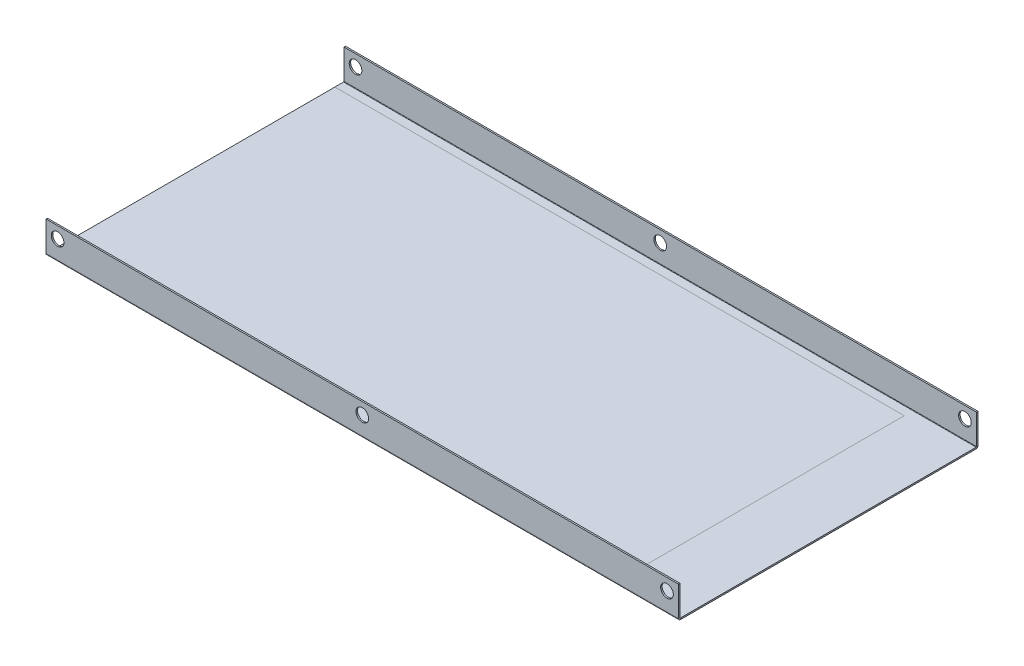
from build123d import *

# Parameters (mm, degrees)
SKETCH_1_W                         = 300
SKETCH_1_H                         = 142
SM_BASE_FLANGE_1_DEPTH             = 0.7
SM_EDGE_FLANGE_1_STRIP_W           = 3.2
SM_EDGE_FLANGE_1_STRIP_H           = 0.7
SM_EDGE_FLANGE_1_STRIP_CUT_DEPTH   = 300
SM_EDGE_FLANGE_1_STRIP_2_W         = 3.2
SM_EDGE_FLANGE_1_STRIP_2_H         = 0.7
SM_EDGE_FLANGE_1_STRIP_CUT_2_DEPTH = 300
SM_EDGE_FLANGE_1_DEPTH             = 300
SM_EDGE_FLANGE_1_BEND_DEPTH        = 300
SKETCH_18_R                        = 3
CUT_EXTRUDE_1_DEPTH                = 10
CUT_EXTRUDE_START                  = -10
SKETCH_20_R                        = 3
CUT_EXTRUDE_2_DEPTH                = 10
SPLIT_BODIES_1_SURFACE_1_BACK      = 333.248
SPLIT_BODIES_1_SURFACE_1_DEPTH     = 666.496
SPLIT_BODIES_1_SURFACE_2_BACK      = 333.248
SPLIT_BODIES_1_SURFACE_2_DEPTH     = 666.496


# Sheet-metal steps are written as plain solids
with BuildPart() as part:
    # 草图1 → 基体-法兰1 (new body)
    with BuildSketch(Plane(origin=(0, 0, 0), x_dir=(1, 0, 0), z_dir=(0, 1, 0))):
        Rectangle(SKETCH_1_W, SKETCH_1_H)
    extrude(amount=-SM_BASE_FLANGE_1_DEPTH)

    # 边线-法兰1 strip (across the edge) → 边线-法兰1 strip cut (cut)
    with BuildSketch(Plane(origin=(150, 0, -71), x_dir=(0, 0, 1), z_dir=(-1, 0, 0))):
        with Locations((-0.7, -0.35)):
            Rectangle(SM_EDGE_FLANGE_1_STRIP_W, SM_EDGE_FLANGE_1_STRIP_H)
    extrude(amount=SM_EDGE_FLANGE_1_STRIP_CUT_DEPTH, mode=Mode.SUBTRACT)

    # 边线-法兰1 strip 2 (across the edge) → 边线-法兰1 strip cut 2 (cut)
    with BuildSketch(Plane(origin=(-150, 0, 71), x_dir=(0, 0, -1), z_dir=(1, 0, 0))):
        with Locations((-0.7, -0.35)):
            Rectangle(SM_EDGE_FLANGE_1_STRIP_2_W, SM_EDGE_FLANGE_1_STRIP_2_H)
    extrude(amount=SM_EDGE_FLANGE_1_STRIP_CUT_2_DEPTH, mode=Mode.SUBTRACT)

    # 边线-法兰1 section (across the edge) → 边线-法兰1 (add)
    with BuildSketch(Plane(origin=(150, 0, -71), x_dir=(0, 0, 1), z_dir=(-1, 0, 0))):
        with BuildLine():
            Line((0, 0.2), (0, 14.3))
            Line((0, 14.3), (0.7, 14.3))
            Line((0.7, 14.3), (0.7, 0.2))
            ThreePointArc((0.7, 0.2), (0.758578644, 0.058578644), (0.9, 0))
            Line((0.9, 0), (0.9, -0.7))
            ThreePointArc((0.9, -0.7), (0.263603897, -0.436396103), (0, 0.2))
        make_face()
    extrude(amount=SM_EDGE_FLANGE_1_DEPTH)

    # 边线-法兰1 section 2 (across the edge) → 边线-法兰1 bend (add)
    with BuildSketch(Plane(origin=(-150, 0, 71), x_dir=(0, 0, -1), z_dir=(1, 0, 0))):
        with BuildLine():
            Line((0, 0.2), (0, 14.3))
            Line((0, 14.3), (0.7, 14.3))
            Line((0.7, 14.3), (0.7, 0.2))
            ThreePointArc((0.7, 0.2), (0.758578644, 0.058578644), (0.9, 0))
            Line((0.9, 0), (0.9, -0.7))
            ThreePointArc((0.9, -0.7), (0.263603897, -0.436396103), (0, 0.2))
        make_face()
    extrude(amount=SM_EDGE_FLANGE_1_BEND_DEPTH)

    # 草图18 → 切除-拉伸1 (cut)
    with BuildSketch(Plane(origin=(0, 0, -71), x_dir=(-1, 0, 0), z_dir=(0, 0, -1))):
        with Locations(Location((-144.5, 8.8, 0), (0, 0, 90))):
            Circle(SKETCH_18_R)
        with Locations(Location((0, 8.8, 0), (0, 0, 90))):
            Circle(SKETCH_18_R)
        with Locations(Location((144.5, 8.8, 0), (0, 0, 270))):
            Circle(SKETCH_18_R)
    extrude(amount=-CUT_EXTRUDE_1_DEPTH, mode=Mode.SUBTRACT)

    # 草图20 → 切除-拉伸2 (cut)
    with BuildSketch(Plane.XY.offset(71).offset(CUT_EXTRUDE_START)):
        with Locations(Location((-144.5, 8.8, 0), (0, 0, 270))):
            Circle(SKETCH_20_R)
        with Locations(Location((0, 8.8, 0), (0, 0, 90))):
            Circle(SKETCH_20_R)
        with Locations(Location((144.5, 8.8, 0), (0, 0, 90))):
            Circle(SKETCH_20_R)
    extrude(amount=CUT_EXTRUDE_2_DEPTH, mode=Mode.SUBTRACT)


with BuildPart() as body_2:
    # Split Bodies 1: the piece behind the surface
    add(part.part)
    # Split Bodies 1 surface: a surface, the sketch's curves swept straight by 666.496 mm
    with BuildLine(Plane(origin=(0, 0, 0), x_dir=(1, 0, 0), z_dir=(0, 1, 0)).offset(-SPLIT_BODIES_1_SURFACE_1_BACK), mode=Mode.PRIVATE) as split_bodies_1_surface_1_path:
        Line((-150, 66), (120, 66))
        Line((120, 66), (120, -66))
        Line((120, -66), (-150, -66))
    split_bodies_1_surface_1 = Shell.extrude(split_bodies_1_surface_1_path.wire(), (0 * SPLIT_BODIES_1_SURFACE_1_DEPTH, 1 * SPLIT_BODIES_1_SURFACE_1_DEPTH, 0 * SPLIT_BODIES_1_SURFACE_1_DEPTH))
    split(bisect_by=split_bodies_1_surface_1, keep=Keep.BOTTOM)


with BuildPart() as part_1:
    add(part.part)

    # Split Bodies 1: split by a surface, the side it looks to stays
    # Split Bodies 1 surface: a surface, the sketch's curves swept straight by 666.496 mm
    with BuildLine(Plane(origin=(0, 0, 0), x_dir=(1, 0, 0), z_dir=(0, 1, 0)).offset(-SPLIT_BODIES_1_SURFACE_2_BACK), mode=Mode.PRIVATE) as split_bodies_1_surface_2_path:
        Line((-150, 66), (120, 66))
        Line((120, 66), (120, -66))
        Line((120, -66), (-150, -66))
    split_bodies_1_surface_2 = Shell.extrude(split_bodies_1_surface_2_path.wire(), (0 * SPLIT_BODIES_1_SURFACE_2_DEPTH, 1 * SPLIT_BODIES_1_SURFACE_2_DEPTH, 0 * SPLIT_BODIES_1_SURFACE_2_DEPTH))
    split(bisect_by=split_bodies_1_surface_2, keep=Keep.TOP)


solid = Compound([body_2.part, part_1.part])
